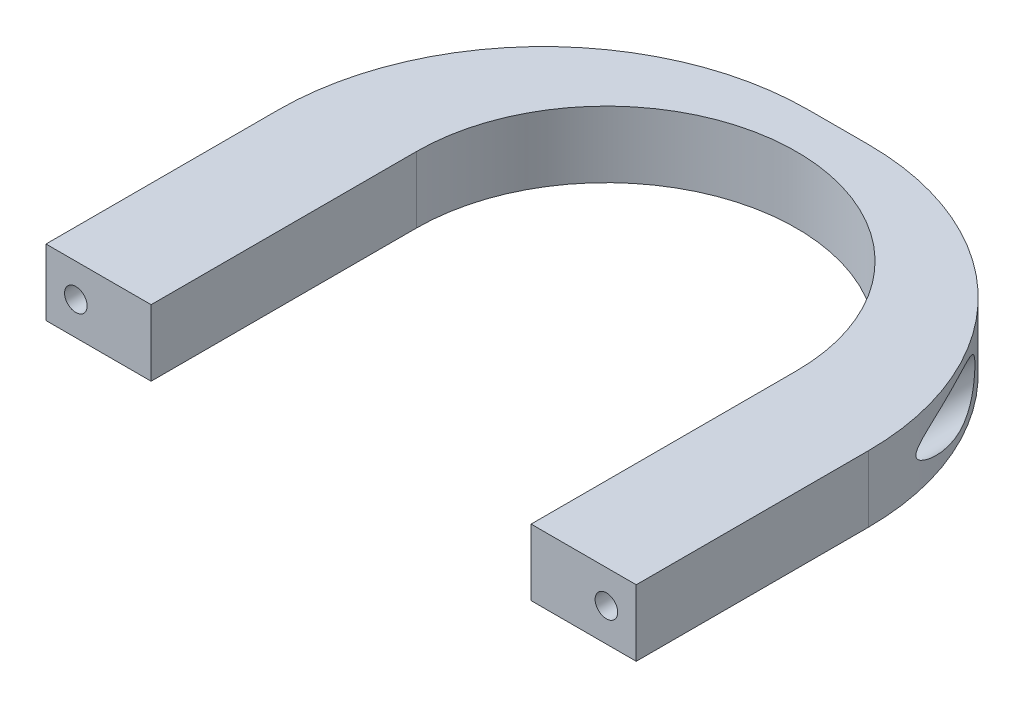
from build123d import *

# Parameters (mm, degrees)
EXTRUDE_1_DEPTH     = 10
SKETCH_2_R          = 1.7
CUT_EXTRUDE_1_DEPTH = 90
SKETCH_3_R          = 3.7
CUT_EXTRUDE_2_DEPTH = 43
FILLET_1_R          = 40


with BuildPart() as part:
    # 草图1 → 凸台-拉伸1 (new body)
    with BuildSketch(Plane(origin=(0, 0, 0), x_dir=(1, 0, 0), z_dir=(0, 1, 0))):
        with BuildLine():
            Line((28.65, -40), (44.5, -40))
            Line((44.5, -40), (44.5, 35))
            Line((44.5, 35), (-44.5, 35))
            Line((-44.5, 35), (-44.5, -40))
            Line((-44.5, -40), (-28.65, -40))
            Line((-28.65, -40), (-28.65, 0))
            ThreePointArc((-28.65, 0), (0, 28.65), (28.65, 0))
            Line((28.65, 0), (28.65, -40))
        make_face()
    extrude(amount=EXTRUDE_1_DEPTH)

    # 草图2 → 切除-拉伸1 (cut)
    with BuildSketch(Plane.XY.offset(40)):
        with Locations((-40, 5)):
            Circle(SKETCH_2_R)
        with Locations((40, 5)):
            Circle(SKETCH_2_R)
    extrude(amount=-CUT_EXTRUDE_1_DEPTH, mode=Mode.SUBTRACT)

    # 草图3 → 切除-拉伸2 (cut)
    with BuildSketch(Plane(origin=(0, 0, -35), x_dir=(-1, 0, 0), z_dir=(0, 0, -1))):
        with Locations((40, 5)):
            Circle(SKETCH_3_R)
        with Locations((-39.998802569, 5)):
            Circle(SKETCH_3_R)
    extrude(amount=-CUT_EXTRUDE_2_DEPTH, mode=Mode.SUBTRACT)

    # 圆角1
    # the kernel refuses this fillet: 40 mm, written as the material it takes off along each edge
    with BuildSketch(Plane(origin=(-44.5, -100, -35), x_dir=(1, 0, 0), z_dir=(0, 1, 0)), Plane(origin=(44.5, -100, -35), x_dir=(0, 0, 1), z_dir=(0, 1, 0))) as fillet_1_piece_1:
        with BuildLine():
            CenterArc((FILLET_1_R, -FILLET_1_R), FILLET_1_R, 90, 90)
            Line((0, -FILLET_1_R), (0, 0))
            Line((0, 0), (FILLET_1_R, 0))
        make_face()
    extrude(amount=210, mode=Mode.SUBTRACT)


solid = part.part
